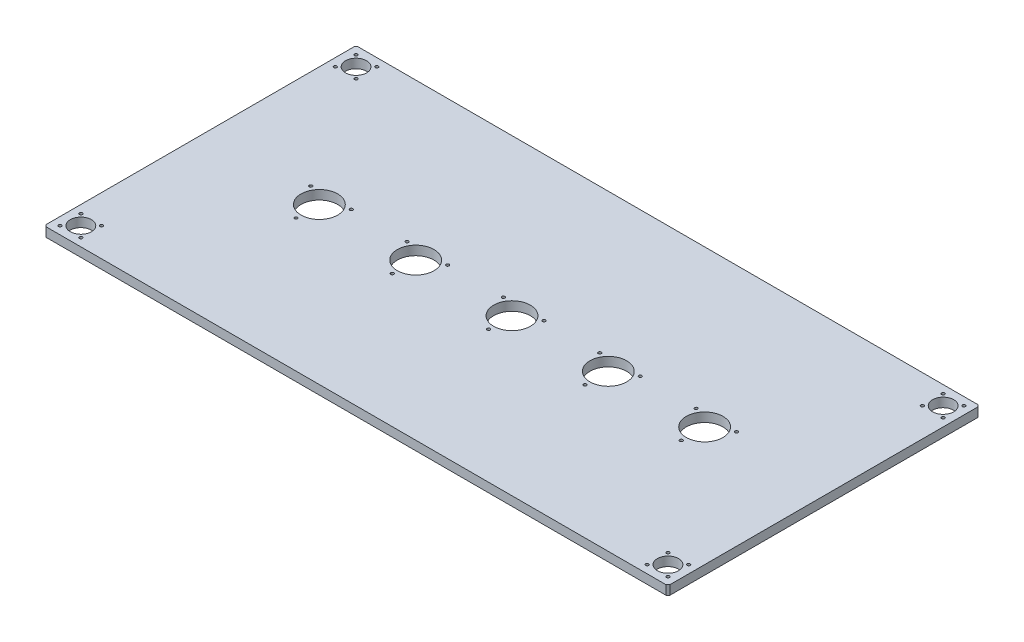
from build123d import *

# Parameters (mm, degrees)
SKETCH1_W             = 680
SKETCH1_H             = 340
SKETCH1_R             = 11.5
SKETCH1_R_2           = 20
BOSS_EXTRUDE1_DEPTH   = 10
CHAMFER1_SIZE         = 2
M4X0_7_TAPPED_HOLE1_D = 3.3
MIRROR2_COPY_1_D      = 3.3
MIRROR2_COPY_2_D      = 3.3
M4X0_7_TAPPED_HOLE2_D = 3.3
LPATTERN1_COUNT       = 3
LPATTERN1_PITCH       = 105
LPATTERN1_COUNT_DIR2  = 3
LPATTERN1_PITCH_DIR2  = 105


with BuildPart() as part:
    # Sketch1 → Boss-Extrude1 (new body)
    with BuildSketch(Plane(origin=(0, 0, 0), x_dir=(1, 0, 0), z_dir=(0, 1, 0))):
        Rectangle(SKETCH1_W, SKETCH1_H)
        with Locations((-320, -150)):
            Circle(SKETCH1_R, mode=Mode.SUBTRACT)
        Circle(SKETCH1_R_2, mode=Mode.SUBTRACT)
        with Locations((-320, 150)):
            Circle(SKETCH1_R, mode=Mode.SUBTRACT)
        with Locations((320, 150)):
            Circle(SKETCH1_R, mode=Mode.SUBTRACT)
        with Locations((320, -150)):
            Circle(SKETCH1_R, mode=Mode.SUBTRACT)
        with Locations((-105, 0)):
            Circle(SKETCH1_R_2, mode=Mode.SUBTRACT)
        with Locations((-210, 0)):
            Circle(SKETCH1_R_2, mode=Mode.SUBTRACT)
        with Locations((105, 0)):
            Circle(SKETCH1_R_2, mode=Mode.SUBTRACT)
        with Locations((210, 0)):
            Circle(SKETCH1_R_2, mode=Mode.SUBTRACT)
    extrude(amount=BOSS_EXTRUDE1_DEPTH)

    # Chamfer1
    chamfer1_edges = [part.edges().sort_by_distance(p)[0] for p in [
        (340, 5, -170),
        (340, 5, 170),
        (-340, 5, 170),
        (-340, 5, -170),
    ]]
    chamfer(chamfer1_edges, length=CHAMFER1_SIZE)

    # M4x0.7 Tapped Hole1 (through all)
    with Locations(Plane(origin=(-331.313708499, 10, 138.686291501), x_dir=(0, 0, 1), z_dir=(0, 1, 0))):
        with Locations((0, 0), (0, 22.627416998), (22.627416998, 22.627416998), (22.627416998, 0)):
            m4x0_7_tapped_hole1 = Hole(M4X0_7_TAPPED_HOLE1_D / 2)

    # Mirror1: M4x0.7 Tapped Hole1 across plane
    add(m4x0_7_tapped_hole1.mirror(Plane.XY), mode=Mode.SUBTRACT)

    # Mirror2 copy 1 (through all)
    with Locations(Plane(origin=(331.313708499, 10, -138.686291501), x_dir=(0, 0, -1), z_dir=(0, 1, 0))):
        with Locations((0, 0), (0, 22.627416998), (22.627416998, 22.627416998), (22.627416998, 0)):
            Hole(MIRROR2_COPY_1_D / 2)

    # Mirror2 copy 2 (through all)
    with Locations(Plane(origin=(331.313708499, 10, 138.686291501), x_dir=(0, 0, 1), z_dir=(0, 1, 0))):
        with Locations((0, 0), (0, -22.627416998), (22.627416998, -22.627416998), (22.627416998, 0)):
            Hole(MIRROR2_COPY_2_D / 2)

    # M4x0.7 Tapped Hole2 (through all)
    with Locations(Plane(origin=(-22.083647797, 10, -12.75), x_dir=(0, 0, 1), z_dir=(0, 1, 0))):
        with Locations((0, 0), (0, 44.167295594), (38.25, 22.083647797)):
            m4x0_7_tapped_hole2 = Hole(M4X0_7_TAPPED_HOLE2_D / 2)

    # LPattern1: M4x0.7 Tapped Hole2 3 × 3
    with Locations(*[Vector(1, 0, 0) * (i * LPATTERN1_PITCH) + Vector(-1, 0, 0) * (j * LPATTERN1_PITCH_DIR2) for i in range(LPATTERN1_COUNT) for j in range(LPATTERN1_COUNT_DIR2) if (i, j) != (0, 0)]):
        add(m4x0_7_tapped_hole2, mode=Mode.SUBTRACT)


solid = part.part
